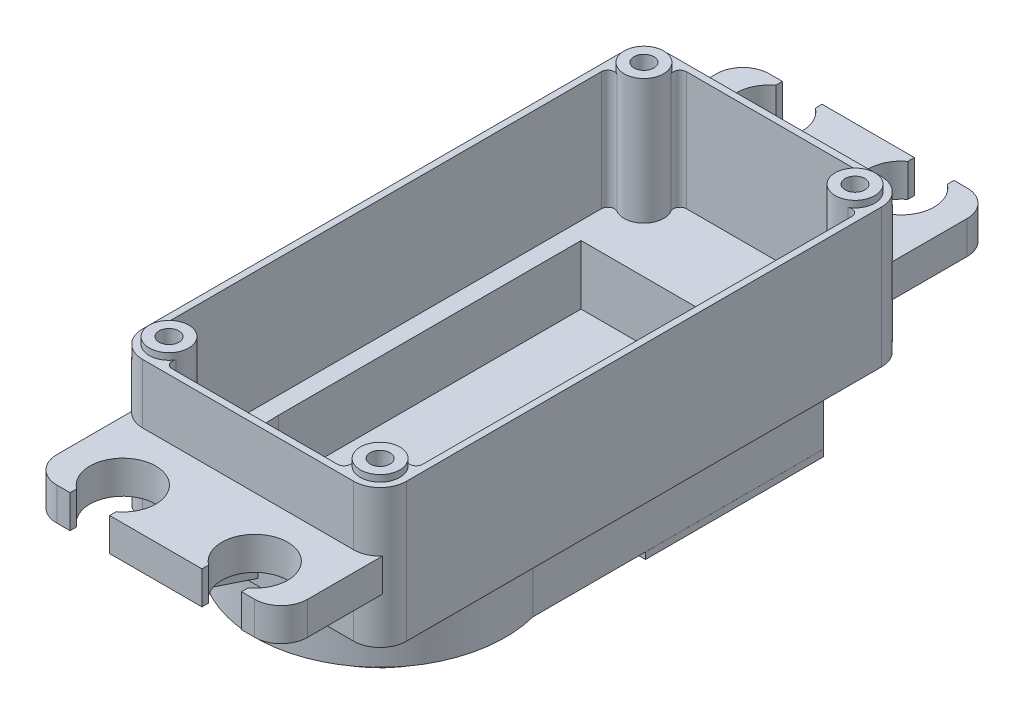
from build123d import *
from build123d.topology import SkipClean

# Parameters (mm, degrees)
ESQUISSE1_W                                     = 40
ESQUISSE1_H                                     = 10.5
BOSS_EXTRU_1_DEPTH                              = 0.8000000000000019
BOSS_EXTRU_2_DEPTH                              = 18.4
BOSS_EXTRU_3_DEPTH                              = 0.7999999999999987
BOSS_EXTRU_4_DEPTH                              = 3.499999999999998
BOSS_EXTRU_5_DEPTH                              = 0.5000000000000004
BOSS_EXTRU_6_DEPTH                              = 0.5000000000000004
ESQUISSE7_W                                     = 19
ESQUISSE7_H                                     = 2.5
BOSS_EXTRU_7_DEPTH                              = 7
BOSS_EXTRU_8_DEPTH                              = 7
BOSS_EXTRU_9_DEPTH                              = 2.4999999999999987
ENL_V_MAT_EXTRU_5_DEPTH                         = 2
ENL_V_MAT_EXTRU_6_DEPTH                         = 0.5000000000000004
DIAM_TRE_DU_PER_AGE_1_5_1_5_1_D                 = 1.5
DIAM_TRE_DU_PER_AGE_1_5_1_5_1_DEPTH             = 2
CHAMBRAGE_POUR_VIS_T_TE_CYLINDRIQUE_D           = 2
CHAMBRAGE_POUR_VIS_T_TE_CYLINDRIQUE_DEPTH       = 16.8
CHAMBRAGE_POUR_VIS_T_TE_CYLINDRIQUE_CBORE_D     = 5.5
CHAMBRAGE_POUR_VIS_T_TE_CYLINDRIQUE_CBORE_DEPTH = 1.5
NERVURE1_START                                  = -0.75
NERVURE1_DEPTH                                  = 1.5
NERVURE2_START                                  = -0.75
NERVURE2_DEPTH                                  = 1.5
CONG_4_R                                        = 1.2
CONG_5_R                                        = 2
ENL_V_MAT_EXTRU_7_DEPTH                         = 10
CONG_6_START                                    = -3
CONG_6_DEPTH                                    = 3
CONG_7_R                                        = 0.5
ENL_V_START                                     = -6.9999999999999964
ENL_V_MAT_EXTRU_8_DEPTH                         = 6.9999999999999964
ESQUISSE29_R                                    = 5.974465748667868
ENL_V_MAT_EXTRU_9_DEPTH                         = 5.9999999999999964
ENL_V_MAT_EXTRU_10_DEPTH                        = 4.5
ESQUISSE31_R                                    = 1.5000000000000009
ESQUISSE31_R_2                                  = 0.7499999999999878
ESQUISSE31_R_3                                  = 0.7499999999999954
ESQUISSE31_R_4                                  = 1.4999999999999973
ESQUISSE31_R_5                                  = 0.7499999999999971
BOSS_EXTRU_10_DEPTH                             = 0.5


with BuildPart() as part:
    # Esquisse1 → Boss.-Extru.1 (new body)
    with BuildSketch(Plane(origin=(-10.446500956022929, 0, 0), x_dir=(0, 0, -1), z_dir=(1, 0, 0))):
        with Locations((-31.770554493307827, -5.25)):
            Rectangle(ESQUISSE1_W, ESQUISSE1_H)
    extrude(amount=-BOSS_EXTRU_1_DEPTH)

    # Esquisse2 → Boss.-Extru.2 (add)
    with BuildSketch(Plane.ZY.offset(11.246500956022931)):
        Polygon((12.570554493307831, -11), (12.570554493307831, -10.5), (11.770554493307829, -10.5), (11.770554493307836, 0), (51.77055449330783, 0), (51.77055449330783, -10.5), (50.97055449330782, -10.5), (50.97055449330782, -11), align=None)
    extrude(amount=BOSS_EXTRU_2_DEPTH)

    # Esquisse3 → Boss.-Extru.3 (add)
    with BuildSketch(Plane.ZY.offset(29.64650095602293)):
        Polygon((11.770554493307838, 0), (51.77055449330783, 0), (51.77055449330783, -10.5), (11.77055449330783, -10.5), align=None)
    extrude(amount=BOSS_EXTRU_3_DEPTH)

    # Esquisse4 → Boss.-Extru.4 (add)
    with BuildSketch(Plane.XZ.offset(11)):
        with BuildLine():
            Line((-29.646500956022926, 17.35331386569952), (-29.646500956022926, 39.402010636842434))
            ThreePointArc((-29.646500956022926, 39.402010636842434), (-20.443205964941416, 51.270553921888535), (-11.24814618644997, 39.395629329629095))
            Line((-11.24814618644997, 39.395629329629095), (-11.248146186449967, 17.353313865699523))
            Line((-11.248146186449967, 17.353313865699523), (-29.646500956022926, 17.35331386569952))
        make_face()
    extrude(amount=BOSS_EXTRU_4_DEPTH)

    # Esquisse5 → Boss.-Extru.5 (add)
    with BuildSketch(Plane.XZ.offset(14.499999999999996)):
        Polygon((-29.646500956022926, 30.85331396465751), (-11.246500956022928, 30.85331396465751), (-11.246500956022928, 17.35331392707599), (-29.646500956022926, 17.353313927075988), align=None)
    extrude(amount=BOSS_EXTRU_5_DEPTH)

    # Esquisse6 → Boss.-Extru.6 (add)
    with BuildSketch(Plane.XZ.offset(14.499999999999996)):
        with BuildLine():
            Line((-18.155213108545006, 30.853313927075984), (-22.737788803500845, 30.853313927075984))
            ThreePointArc((-22.737788803500845, 30.853313927075984), (-20.446500956022927, 32.35331392707598), (-18.155213108545006, 30.853313927075984))
        make_face()
    extrude(amount=BOSS_EXTRU_6_DEPTH)

    # Esquisse7 → Boss.-Extru.7 (add)
    with BuildSketch(Plane.XY.offset(51.77055449330783)):
        with Locations((-20.446500956022934, -5.750000000000001)):
            Rectangle(ESQUISSE7_W, ESQUISSE7_H)
    extrude(amount=BOSS_EXTRU_7_DEPTH)

    # Esquisse10 → Boss.-Extru.8 (add)
    with BuildSketch(Plane(origin=(0, 0, 11.770554493307827), x_dir=(-1, 0, 0), z_dir=(0, 0, -1))):
        Polygon((29.94650095602292, -4.500000000000001), (29.94650095602292, -7.000000000000001), (10.946500956022927, -7.000000000000001), (10.946500956022925, -4.500000000000001), align=None)
    extrude(amount=BOSS_EXTRU_8_DEPTH)

    # Esquisse13 → Boss.-Extru.9 (add)
    with BuildSketch(Plane.XZ.offset(11)):
        with BuildLine():
            Line((-24.731395334360055, 17.353313927075984), (-16.161681220108637, 17.353313927075984))
            ThreePointArc((-16.161681220108637, 17.353313927075984), (-20.446538277234346, 15.553313927075983), (-24.731395334360055, 17.353313927075984))
        make_face()
    extrude(amount=BOSS_EXTRU_9_DEPTH)

    # Esquisse14 → Enlèv. mat.-Extru.5 (cut)
    with BuildSketch(Plane(origin=(0, 0, 0), x_dir=(-1, 0, 0), z_dir=(0, 1, 0))):
        with BuildLine():
            Line((10.946500956022929, 49.77055449330783), (10.946500956022927, 13.770554493307829))
            ThreePointArc((10.946500956022927, 13.770554493307829), (13.507161127802748, 14.83121466508765), (12.446500956022927, 12.270554493307827))
            Line((12.446500956022927, 12.270554493307827), (28.446500956022927, 12.270554493307827))
            ThreePointArc((28.446500956022927, 12.270554493307827), (27.385840784243104, 14.831214665087652), (29.946500956022927, 13.770554493307829))
            Line((29.946500956022927, 13.770554493307829), (29.946500956022927, 49.77055449330783))
            ThreePointArc((29.946500956022927, 49.77055449330783), (27.38584078424311, 48.70989432152801), (28.44650095602293, 51.27055449330783))
            Line((28.44650095602293, 51.27055449330783), (12.44650095602293, 51.27055449330783))
            ThreePointArc((12.44650095602293, 51.27055449330783), (13.507161127802751, 48.709894321528004), (10.946500956022929, 49.77055449330783))
        make_face()
    extrude(amount=-ENL_V_MAT_EXTRU_5_DEPTH, mode=Mode.SUBTRACT)

    # Esquisse15 → Enlèv. mat.-Extru.6 (cut)
    with BuildSketch(Plane.XZ.offset(14.999999999999998)):
        Polygon((-12.246500956022928, 29.853313927075984), (-28.646500956022926, 29.853313927075984), (-28.646500956022926, 18.353313927075984), (-12.246500956022928, 18.353313927075988), align=None)
    extrude(amount=-ENL_V_MAT_EXTRU_6_DEPTH, mode=Mode.SUBTRACT)

    # Esquisse20 → Révolution1 (revolve)
    with BuildSketch(Plane(origin=(0, 0, 41.77055449330783), x_dir=(-1, 0, 0), z_dir=(0, 0, -1)), mode=Mode.PRIVATE) as r_volution1_sk:
        Polygon((15.446500956022925, -16.8), (20.446500956022927, -16.8), (20.446500956022927, -14.499999999999996), (13.446500956022927, -14.499999999999996), (13.446500956022927, -16.299999999999997), (15.446500956022925, -16.299999999999997), align=None)
    revolve(r_volution1_sk.sketch.rotate(Axis((-20.446500956022927, -16.8, 41.77055449330783), (0, 1, 0)), 270), axis=Axis((-20.446500956022927, -16.8, 41.77055449330783), (0, 1, 0)))

    # Diamètre du perçage Ø1.5 (1.5)1
    with Locations(Plane(origin=(0, 0, 0), x_dir=(1, 0, 0), z_dir=(0, 1, 0))):
        with Locations((-12.446500956, -49.770554493), (-28.446500956, -49.770554493), (-12.446500956, -13.770554493), (-28.446500956, -13.770554493)):
            Hole(DIAM_TRE_DU_PER_AGE_1_5_1_5_1_D / 2, depth=DIAM_TRE_DU_PER_AGE_1_5_1_5_1_DEPTH)

    # Chambrage pour vis à tête cylindrique à 6 pans creux (ou vis CHC) M1.61
    with Locations(Plane(origin=(0, -16.8, 0), x_dir=(-1, 0, 0), z_dir=(0, -1, 0))):
        with Locations((20.446500956, -41.770554493)):
            CounterBoreHole(CHAMBRAGE_POUR_VIS_T_TE_CYLINDRIQUE_D / 2, CHAMBRAGE_POUR_VIS_T_TE_CYLINDRIQUE_CBORE_D / 2, CHAMBRAGE_POUR_VIS_T_TE_CYLINDRIQUE_CBORE_DEPTH, depth=CHAMBRAGE_POUR_VIS_T_TE_CYLINDRIQUE_DEPTH)

    # Nervure1: read off the stored shape, not the designer's step
    # Nervure1 outline → Nervure1 (add)
    with BuildSketch(Plane(origin=(-20.446500956022927, 0, 0), x_dir=(0, -1, 0), z_dir=(-1, 0, 0)).offset(NERVURE1_START)):
        Polygon((10, 51.770554493), (8, 57.770554493), (7, 57.770554493), (7, 51.770554493), align=None)
    extrude(amount=NERVURE1_DEPTH)

    # Nervure2: read off the stored shape, not the designer's step
    # Nervure2 outline → Nervure2 (add)
    with BuildSketch(Plane(origin=(-20.446500956022927, 0, 0), x_dir=(0, -1, 0), z_dir=(-1, 0, 0)).offset(NERVURE2_START)):
        Polygon((7, 11.770554493), (7, 5.770554493), (8, 5.770554493), (10, 11.770554493), align=None)
    extrude(amount=NERVURE2_DEPTH)

    # Congé4
    cong_4_edges = [part.edges().sort_by_distance(p)[0] for p in [
        (-11.246500956022931, -10.75, 50.97055449330782),
        (-29.64650095602293, -10.75, 12.570554493307831),
        (-11.246500956022931, -10.75, 12.570554493307831),
        (-29.64650095602293, -10.75, 50.97055449330782),
    ]]
    fillet(cong_4_edges, radius=CONG_4_R)

    # Congé5
    # the kernel refuses this fillet: 2 mm, written as the material it takes off along each edge
    with BuildSketch(Plane(origin=(-30.446500956022927, -15.5, 11.770554493307827), x_dir=(-1.78e-15, -6.8e-16, 1), z_dir=(0, 1, 6.8e-16))) as cong_5_piece_1_section:
        with BuildLine():
            CenterArc((CONG_5_R, CONG_5_R), CONG_5_R, 180.0000000000001, 90)
            Line((-3.55e-15, CONG_5_R), (0, 0))
            Line((0, 0), (CONG_5_R, 0))
        make_face()
    cong_5_piece_1 = extrude(amount=20.5, mode=Mode.PRIVATE)
    cong_5_piece_1 = split(cong_5_piece_1, bisect_by=Plane(origin=(-30.446500956022927, -7, 11.770554493307827), z_dir=(0, -1, 0)), keep=Keep.TOP, mode=Mode.PRIVATE)
    cong_5_piece_1 = split(cong_5_piece_1, bisect_by=Plane(origin=(-29.94650095602292, -15.5, 11.770554493307827), z_dir=(-1, 0, 0)), keep=Keep.TOP, mode=Mode.PRIVATE)
    add(cong_5_piece_1, mode=Mode.SUBTRACT)
    with BuildSketch(Plane(origin=(-30.446500956022927, -15.5, 11.770554493307827), x_dir=(-1.78e-15, -6.8e-16, 1), z_dir=(0, 1, 6.8e-16))) as cong_5_piece_2_section:
        with BuildLine():
            CenterArc((CONG_5_R, CONG_5_R), CONG_5_R, 180.0000000000001, 90)
            Line((-3.55e-15, CONG_5_R), (0, 0))
            Line((0, 0), (CONG_5_R, 0))
        make_face()
    cong_5_piece_2 = extrude(amount=20.5, mode=Mode.PRIVATE)
    cong_5_piece_2 = split(cong_5_piece_2, bisect_by=Plane(origin=(-30.446500956022927, -7, 11.770554493307827), z_dir=(0, -1, 0)), keep=Keep.TOP, mode=Mode.PRIVATE)
    cong_5_piece_2 = split(cong_5_piece_2, bisect_by=Plane(origin=(-29.94650095602292, -15.5, 11.770554493307827), z_dir=(1, 0, 0)), keep=Keep.TOP, mode=Mode.PRIVATE)
    add(cong_5_piece_2, mode=Mode.SUBTRACT)
    with BuildSketch(Plane(origin=(-30.446500956022927, -15.5, 11.770554493307827), x_dir=(-1.78e-15, -6.8e-16, 1), z_dir=(0, 1, 6.8e-16))) as cong_5_piece_3_section:
        with BuildLine():
            CenterArc((CONG_5_R, CONG_5_R), CONG_5_R, 180.0000000000001, 90)
            Line((-3.55e-15, CONG_5_R), (0, 0))
            Line((0, 0), (CONG_5_R, 0))
        make_face()
    cong_5_piece_3 = extrude(amount=20.5, mode=Mode.PRIVATE)
    cong_5_piece_3 = split(cong_5_piece_3, bisect_by=Plane(origin=(-30.446500956022927, -7, 11.770554493307827), z_dir=(0, 1, 0)), keep=Keep.TOP, mode=Mode.PRIVATE)
    cong_5_piece_3 = split(cong_5_piece_3, bisect_by=Plane(origin=(-29.94650095602292, -15.5, 11.770554493307827), z_dir=(-1, 0, 0)), keep=Keep.TOP, mode=Mode.PRIVATE)
    cong_5_piece_3 = split(cong_5_piece_3, bisect_by=Plane(origin=(-30.446500956022927, -4.5, 11.770554493307827), z_dir=(0, -1, 0)), keep=Keep.TOP, mode=Mode.PRIVATE)
    add(cong_5_piece_3, mode=Mode.SUBTRACT)
    with BuildSketch(Plane(origin=(-30.446500956022927, -15.5, 11.770554493307827), x_dir=(-1.78e-15, -6.8e-16, 1), z_dir=(0, 1, 6.8e-16))) as cong_5_piece_4_section:
        with BuildLine():
            CenterArc((CONG_5_R, CONG_5_R), CONG_5_R, 180.0000000000001, 90)
            Line((-3.55e-15, CONG_5_R), (0, 0))
            Line((0, 0), (CONG_5_R, 0))
        make_face()
    cong_5_piece_4 = extrude(amount=20.5, mode=Mode.PRIVATE)
    cong_5_piece_4 = split(cong_5_piece_4, bisect_by=Plane(origin=(-29.94650095602292, -15.5, 11.770554493307827), z_dir=(-1, 0, 0)), keep=Keep.TOP, mode=Mode.PRIVATE)
    cong_5_piece_4 = split(cong_5_piece_4, bisect_by=Plane(origin=(-30.446500956022927, -4.5, 11.770554493307827), z_dir=(0, 1, 0)), keep=Keep.TOP, mode=Mode.PRIVATE)
    add(cong_5_piece_4, mode=Mode.SUBTRACT)
    with BuildSketch(Plane(origin=(-30.446500956022927, -15.5, 11.770554493307827), x_dir=(-1.78e-15, -6.8e-16, 1), z_dir=(0, 1, 6.8e-16))) as cong_5_piece_5_section:
        with BuildLine():
            CenterArc((CONG_5_R, CONG_5_R), CONG_5_R, 180.0000000000001, 90)
            Line((-3.55e-15, CONG_5_R), (0, 0))
            Line((0, 0), (CONG_5_R, 0))
        make_face()
    cong_5_piece_5 = extrude(amount=20.5, mode=Mode.PRIVATE)
    cong_5_piece_5 = split(cong_5_piece_5, bisect_by=Plane(origin=(-29.94650095602292, -15.5, 11.770554493307827), z_dir=(1, 0, 0)), keep=Keep.TOP, mode=Mode.PRIVATE)
    cong_5_piece_5 = split(cong_5_piece_5, bisect_by=Plane(origin=(-30.446500956022927, -4.5, 11.770554493307827), z_dir=(0, 1, 0)), keep=Keep.TOP, mode=Mode.PRIVATE)
    add(cong_5_piece_5, mode=Mode.SUBTRACT)
    with BuildSketch(Plane(origin=(-10.94650095602293, -12, 4.770554493307827), x_dir=(0, 0, 1), z_dir=(7.1e-16, 1, 0)), Plane(origin=(-29.94650095602292, 0.4999999999999991, 4.770554493307827), x_dir=(0, 0, 1), z_dir=(0, -1, 0))) as cong_5_piece_6:
        with BuildLine():
            CenterArc((CONG_5_R, -CONG_5_R), CONG_5_R, 90, 90)
            Line((0, -CONG_5_R), (0, 0))
            Line((0, 0), (CONG_5_R, 0))
        make_face()
    extrude(amount=12.5, mode=Mode.SUBTRACT)
    with BuildSketch(Plane(origin=(-10.946500956022932, 0.4999999999999991, 58.77055449330783), x_dir=(0, 0, -1), z_dir=(0, -1, 0))) as cong_5_piece_7:
        with BuildLine():
            CenterArc((CONG_5_R, -CONG_5_R), CONG_5_R, 90, 90)
            Line((0, -CONG_5_R), (0, 0))
            Line((0, 0), (CONG_5_R, 0))
        make_face()
    extrude(amount=12.5, mode=Mode.SUBTRACT)
    with BuildSketch(Plane(origin=(-10.446500956022929, -15.5, 11.770554493307827), x_dir=(-1, 0, 0), z_dir=(0, 1, 0))) as cong_5_piece_8_section:
        with BuildLine():
            CenterArc((CONG_5_R, CONG_5_R), CONG_5_R, 180, 90)
            Line((0, CONG_5_R), (0, 0))
            Line((0, 0), (CONG_5_R, 0))
        make_face()
    cong_5_piece_8 = extrude(amount=20.5, mode=Mode.PRIVATE)
    cong_5_piece_8 = split(cong_5_piece_8, bisect_by=Plane(origin=(-10.946500956022934, -15.5, 11.770554493307827), z_dir=(-1, 7.1e-16, 0)), keep=Keep.TOP, mode=Mode.PRIVATE)
    cong_5_piece_8 = split(cong_5_piece_8, bisect_by=Plane(origin=(-10.446500956022929, -7, 11.770554493307827), z_dir=(0, -1, 0)), keep=Keep.TOP, mode=Mode.PRIVATE)
    add(cong_5_piece_8, mode=Mode.SUBTRACT)
    with BuildSketch(Plane(origin=(-10.446500956022929, -15.5, 11.770554493307827), x_dir=(-1, 0, 0), z_dir=(0, 1, 0))) as cong_5_piece_9_section:
        with BuildLine():
            CenterArc((CONG_5_R, CONG_5_R), CONG_5_R, 180, 90)
            Line((0, CONG_5_R), (0, 0))
            Line((0, 0), (CONG_5_R, 0))
        make_face()
    cong_5_piece_9 = extrude(amount=20.5, mode=Mode.PRIVATE)
    cong_5_piece_9 = split(cong_5_piece_9, bisect_by=Plane(origin=(-10.946500956022934, -15.5, 11.770554493307827), z_dir=(1, -7.1e-16, 0)), keep=Keep.TOP, mode=Mode.PRIVATE)
    cong_5_piece_9 = split(cong_5_piece_9, bisect_by=Plane(origin=(-10.446500956022929, -7, 11.770554493307827), z_dir=(0, -1, 0)), keep=Keep.TOP, mode=Mode.PRIVATE)
    add(cong_5_piece_9, mode=Mode.SUBTRACT)
    with BuildSketch(Plane(origin=(-10.446500956022929, -15.5, 11.770554493307827), x_dir=(-1, 0, 0), z_dir=(0, 1, 0))) as cong_5_piece_10_section:
        with BuildLine():
            CenterArc((CONG_5_R, CONG_5_R), CONG_5_R, 180, 90)
            Line((0, CONG_5_R), (0, 0))
            Line((0, 0), (CONG_5_R, 0))
        make_face()
    cong_5_piece_10 = extrude(amount=20.5, mode=Mode.PRIVATE)
    cong_5_piece_10 = split(cong_5_piece_10, bisect_by=Plane(origin=(-10.946500956022932, -15.5, 11.770554493307827), z_dir=(1, -7.1e-16, 0)), keep=Keep.TOP, mode=Mode.PRIVATE)
    cong_5_piece_10 = split(cong_5_piece_10, bisect_by=Plane(origin=(-10.446500956022929, -7, 11.770554493307827), z_dir=(0, 1, 0)), keep=Keep.TOP, mode=Mode.PRIVATE)
    cong_5_piece_10 = split(cong_5_piece_10, bisect_by=Plane(origin=(-10.446500956022929, -4.5, 11.770554493307827), z_dir=(0, -1, 0)), keep=Keep.TOP, mode=Mode.PRIVATE)
    add(cong_5_piece_10, mode=Mode.SUBTRACT)
    with BuildSketch(Plane(origin=(-10.446500956022929, -15.5, 11.770554493307827), x_dir=(-1, 0, 0), z_dir=(0, 1, 0))) as cong_5_piece_11_section:
        with BuildLine():
            CenterArc((CONG_5_R, CONG_5_R), CONG_5_R, 180, 90)
            Line((0, CONG_5_R), (0, 0))
            Line((0, 0), (CONG_5_R, 0))
        make_face()
    cong_5_piece_11 = extrude(amount=20.5, mode=Mode.PRIVATE)
    cong_5_piece_11 = split(cong_5_piece_11, bisect_by=Plane(origin=(-10.946500956022932, -15.5, 11.770554493307827), z_dir=(-1, 7.1e-16, 0)), keep=Keep.TOP, mode=Mode.PRIVATE)
    cong_5_piece_11 = split(cong_5_piece_11, bisect_by=Plane(origin=(-10.446500956022929, -4.5, 11.770554493307827), z_dir=(0, 1, 0)), keep=Keep.TOP, mode=Mode.PRIVATE)
    add(cong_5_piece_11, mode=Mode.SUBTRACT)
    with BuildSketch(Plane(origin=(-10.446500956022929, -15.5, 11.770554493307827), x_dir=(-1, 0, 0), z_dir=(0, 1, 0))) as cong_5_piece_12_section:
        with BuildLine():
            CenterArc((CONG_5_R, CONG_5_R), CONG_5_R, 180, 90)
            Line((0, CONG_5_R), (0, 0))
            Line((0, 0), (CONG_5_R, 0))
        make_face()
    cong_5_piece_12 = extrude(amount=20.5, mode=Mode.PRIVATE)
    cong_5_piece_12 = split(cong_5_piece_12, bisect_by=Plane(origin=(-10.946500956022932, -15.5, 11.770554493307827), z_dir=(1, -7.1e-16, 0)), keep=Keep.TOP, mode=Mode.PRIVATE)
    cong_5_piece_12 = split(cong_5_piece_12, bisect_by=Plane(origin=(-10.446500956022929, -4.5, 11.770554493307827), z_dir=(0, 1, 0)), keep=Keep.TOP, mode=Mode.PRIVATE)
    add(cong_5_piece_12, mode=Mode.SUBTRACT)
    with BuildSketch(Plane(origin=(-10.446500956022929, 5, 51.77055449330783), x_dir=(-1, 0, 0), z_dir=(0, -1, 0))) as cong_5_piece_13_section:
        with BuildLine():
            CenterArc((CONG_5_R, CONG_5_R), CONG_5_R, 180, 90)
            Line((0, CONG_5_R), (0, 0))
            Line((0, 0), (CONG_5_R, 0))
        make_face()
    cong_5_piece_13 = extrude(amount=20.5, mode=Mode.PRIVATE)
    cong_5_piece_13 = split(cong_5_piece_13, bisect_by=Plane(origin=(-10.946500956022932, 5, 51.77055449330783), z_dir=(-1, 0, 0)), keep=Keep.TOP, mode=Mode.PRIVATE)
    cong_5_piece_13 = split(cong_5_piece_13, bisect_by=Plane(origin=(-10.446500956022929, -4.5, 51.77055449330783), z_dir=(0, 1, 0)), keep=Keep.TOP, mode=Mode.PRIVATE)
    add(cong_5_piece_13, mode=Mode.SUBTRACT)
    with BuildSketch(Plane(origin=(-10.446500956022929, 5, 51.77055449330783), x_dir=(-1, 0, 0), z_dir=(0, -1, 0))) as cong_5_piece_14_section:
        with BuildLine():
            CenterArc((CONG_5_R, CONG_5_R), CONG_5_R, 180, 90)
            Line((0, CONG_5_R), (0, 0))
            Line((0, 0), (CONG_5_R, 0))
        make_face()
    cong_5_piece_14 = extrude(amount=20.5, mode=Mode.PRIVATE)
    cong_5_piece_14 = split(cong_5_piece_14, bisect_by=Plane(origin=(-10.946500956022932, 5, 51.77055449330783), z_dir=(1, 0, 0)), keep=Keep.TOP, mode=Mode.PRIVATE)
    cong_5_piece_14 = split(cong_5_piece_14, bisect_by=Plane(origin=(-10.446500956022929, -4.5, 51.77055449330783), z_dir=(0, 1, 0)), keep=Keep.TOP, mode=Mode.PRIVATE)
    add(cong_5_piece_14, mode=Mode.SUBTRACT)
    with BuildSketch(Plane(origin=(-10.446500956022929, 5, 51.77055449330783), x_dir=(-1, 0, 0), z_dir=(0, -1, 0))) as cong_5_piece_15_section:
        with BuildLine():
            CenterArc((CONG_5_R, CONG_5_R), CONG_5_R, 180, 90)
            Line((0, CONG_5_R), (0, 0))
            Line((0, 0), (CONG_5_R, 0))
        make_face()
    cong_5_piece_15 = extrude(amount=20.5, mode=Mode.PRIVATE)
    cong_5_piece_15 = split(cong_5_piece_15, bisect_by=Plane(origin=(-10.446500956022929, -7, 51.77055449330783), z_dir=(0, 1, 0)), keep=Keep.TOP, mode=Mode.PRIVATE)
    cong_5_piece_15 = split(cong_5_piece_15, bisect_by=Plane(origin=(-10.946500956022932, 5, 51.77055449330783), z_dir=(1, 0, 0)), keep=Keep.TOP, mode=Mode.PRIVATE)
    cong_5_piece_15 = split(cong_5_piece_15, bisect_by=Plane(origin=(-10.446500956022929, -4.5, 51.77055449330783), z_dir=(0, -1, 0)), keep=Keep.TOP, mode=Mode.PRIVATE)
    add(cong_5_piece_15, mode=Mode.SUBTRACT)
    with BuildSketch(Plane(origin=(-10.446500956022929, 5, 51.77055449330783), x_dir=(-1, 0, 0), z_dir=(0, -1, 0))) as cong_5_piece_16_section:
        with BuildLine():
            CenterArc((CONG_5_R, CONG_5_R), CONG_5_R, 180, 90)
            Line((0, CONG_5_R), (0, 0))
            Line((0, 0), (CONG_5_R, 0))
        make_face()
    cong_5_piece_16 = extrude(amount=20.5, mode=Mode.PRIVATE)
    cong_5_piece_16 = split(cong_5_piece_16, bisect_by=Plane(origin=(-10.446500956022929, -7, 51.77055449330783), z_dir=(0, -1, 0)), keep=Keep.TOP, mode=Mode.PRIVATE)
    cong_5_piece_16 = split(cong_5_piece_16, bisect_by=Plane(origin=(-10.946500956022932, 5, 51.77055449330783), z_dir=(-1, 0, 0)), keep=Keep.TOP, mode=Mode.PRIVATE)
    add(cong_5_piece_16, mode=Mode.SUBTRACT)
    with BuildSketch(Plane(origin=(-10.446500956022929, 5, 51.77055449330783), x_dir=(-1, 0, 0), z_dir=(0, -1, 0))) as cong_5_piece_17_section:
        with BuildLine():
            CenterArc((CONG_5_R, CONG_5_R), CONG_5_R, 180, 90)
            Line((0, CONG_5_R), (0, 0))
            Line((0, 0), (CONG_5_R, 0))
        make_face()
    cong_5_piece_17 = extrude(amount=20.5, mode=Mode.PRIVATE)
    cong_5_piece_17 = split(cong_5_piece_17, bisect_by=Plane(origin=(-10.446500956022929, -7, 51.77055449330783), z_dir=(0, -1, 0)), keep=Keep.TOP, mode=Mode.PRIVATE)
    cong_5_piece_17 = split(cong_5_piece_17, bisect_by=Plane(origin=(-10.946500956022932, 5, 51.77055449330783), z_dir=(1, 0, 0)), keep=Keep.TOP, mode=Mode.PRIVATE)
    add(cong_5_piece_17, mode=Mode.SUBTRACT)
    with BuildSketch(Plane(origin=(-30.44650095602293, 5, 51.77055449330783), x_dir=(1, 0, 0), z_dir=(0, -1, 0))) as cong_5_piece_18_section:
        with BuildLine():
            CenterArc((CONG_5_R, -CONG_5_R), CONG_5_R, 90, 90)
            Line((0, -CONG_5_R), (0, 0))
            Line((0, 0), (CONG_5_R, 0))
        make_face()
    cong_5_piece_18 = extrude(amount=20.5, mode=Mode.PRIVATE)
    cong_5_piece_18 = split(cong_5_piece_18, bisect_by=Plane(origin=(-29.946500956022934, 5, 51.77055449330783), z_dir=(1, 0, 0)), keep=Keep.TOP, mode=Mode.PRIVATE)
    cong_5_piece_18 = split(cong_5_piece_18, bisect_by=Plane(origin=(-30.44650095602293, -4.5, 51.77055449330783), z_dir=(0, 1, 0)), keep=Keep.TOP, mode=Mode.PRIVATE)
    add(cong_5_piece_18, mode=Mode.SUBTRACT)
    with BuildSketch(Plane(origin=(-30.44650095602293, 5, 51.77055449330783), x_dir=(1, 0, 0), z_dir=(0, -1, 0))) as cong_5_piece_19_section:
        with BuildLine():
            CenterArc((CONG_5_R, -CONG_5_R), CONG_5_R, 90, 90)
            Line((0, -CONG_5_R), (0, 0))
            Line((0, 0), (CONG_5_R, 0))
        make_face()
    cong_5_piece_19 = extrude(amount=20.5, mode=Mode.PRIVATE)
    cong_5_piece_19 = split(cong_5_piece_19, bisect_by=Plane(origin=(-29.946500956022934, 5, 51.77055449330783), z_dir=(-1, 0, 0)), keep=Keep.TOP, mode=Mode.PRIVATE)
    cong_5_piece_19 = split(cong_5_piece_19, bisect_by=Plane(origin=(-30.44650095602293, -4.5, 51.77055449330783), z_dir=(0, 1, 0)), keep=Keep.TOP, mode=Mode.PRIVATE)
    add(cong_5_piece_19, mode=Mode.SUBTRACT)
    with BuildSketch(Plane(origin=(-30.44650095602293, 5, 51.77055449330783), x_dir=(1, 0, 0), z_dir=(0, -1, 0))) as cong_5_piece_20_section:
        with BuildLine():
            CenterArc((CONG_5_R, -CONG_5_R), CONG_5_R, 90, 90)
            Line((0, -CONG_5_R), (0, 0))
            Line((0, 0), (CONG_5_R, 0))
        make_face()
    cong_5_piece_20 = extrude(amount=20.5, mode=Mode.PRIVATE)
    cong_5_piece_20 = split(cong_5_piece_20, bisect_by=Plane(origin=(-29.946500956022934, 5, 51.77055449330783), z_dir=(-1, 0, 0)), keep=Keep.TOP, mode=Mode.PRIVATE)
    cong_5_piece_20 = split(cong_5_piece_20, bisect_by=Plane(origin=(-30.44650095602293, -7, 51.77055449330783), z_dir=(0, 1, 0)), keep=Keep.TOP, mode=Mode.PRIVATE)
    cong_5_piece_20 = split(cong_5_piece_20, bisect_by=Plane(origin=(-30.44650095602293, -4.5, 51.77055449330783), z_dir=(0, -1, 0)), keep=Keep.TOP, mode=Mode.PRIVATE)
    add(cong_5_piece_20, mode=Mode.SUBTRACT)
    with BuildSketch(Plane(origin=(-30.44650095602293, 5, 51.77055449330783), x_dir=(1, 0, 0), z_dir=(0, -1, 0))) as cong_5_piece_21_section:
        with BuildLine():
            CenterArc((CONG_5_R, -CONG_5_R), CONG_5_R, 90, 90)
            Line((0, -CONG_5_R), (0, 0))
            Line((0, 0), (CONG_5_R, 0))
        make_face()
    cong_5_piece_21 = extrude(amount=20.5, mode=Mode.PRIVATE)
    cong_5_piece_21 = split(cong_5_piece_21, bisect_by=Plane(origin=(-29.946500956022934, 5, 51.77055449330783), z_dir=(1, 0, 0)), keep=Keep.TOP, mode=Mode.PRIVATE)
    cong_5_piece_21 = split(cong_5_piece_21, bisect_by=Plane(origin=(-30.44650095602293, -7, 51.77055449330783), z_dir=(0, -1, 0)), keep=Keep.TOP, mode=Mode.PRIVATE)
    add(cong_5_piece_21, mode=Mode.SUBTRACT)
    with BuildSketch(Plane(origin=(-30.44650095602293, 5, 51.77055449330783), x_dir=(1, 0, 0), z_dir=(0, -1, 0))) as cong_5_piece_22_section:
        with BuildLine():
            CenterArc((CONG_5_R, -CONG_5_R), CONG_5_R, 90, 90)
            Line((0, -CONG_5_R), (0, 0))
            Line((0, 0), (CONG_5_R, 0))
        make_face()
    cong_5_piece_22 = extrude(amount=20.5, mode=Mode.PRIVATE)
    cong_5_piece_22 = split(cong_5_piece_22, bisect_by=Plane(origin=(-29.946500956022934, 5, 51.77055449330783), z_dir=(-1, 0, 0)), keep=Keep.TOP, mode=Mode.PRIVATE)
    cong_5_piece_22 = split(cong_5_piece_22, bisect_by=Plane(origin=(-30.44650095602293, -7, 51.77055449330783), z_dir=(0, -1, 0)), keep=Keep.TOP, mode=Mode.PRIVATE)
    add(cong_5_piece_22, mode=Mode.SUBTRACT)
    with BuildSketch(Plane(origin=(-29.946500956022934, -12, 58.77055449330783), x_dir=(0, 0, -1), z_dir=(0, 1, 0))) as cong_5_piece_23:
        with BuildLine():
            CenterArc((CONG_5_R, -CONG_5_R), CONG_5_R, 90, 90)
            Line((0, -CONG_5_R), (0, 0))
            Line((0, 0), (CONG_5_R, 0))
        make_face()
    extrude(amount=12.5, mode=Mode.SUBTRACT)

    # Esquisse27 → Enlèv. mat.-Extru.7 (cut)
    with BuildSketch(Plane.XZ.offset(7.000000000000001)):
        with BuildLine():
            Line((-26.946500956022923, 58.270554493307834), (-26.946500956022923, 59.544005266820506))
            Line((-26.946500956022923, 59.544005266820506), (-23.946500956022923, 59.544005266820506))
            Line((-23.946500956022923, 59.544005266820506), (-23.946500956022923, 58.27055449330783))
            ThreePointArc((-23.946500956022923, 58.27055449330783), (-25.446500956022927, 53.770554493307834), (-26.946500956022923, 58.270554493307834))
        make_face()
        with BuildLine():
            Line((-13.946500956022925, 58.270554493307834), (-13.946500956022925, 59.544005266820506))
            Line((-13.946500956022925, 59.544005266820506), (-16.946500956022923, 59.544005266820506))
            Line((-16.946500956022923, 59.544005266820506), (-16.946500956022923, 58.270554493307834))
            ThreePointArc((-16.946500956022923, 58.270554493307834), (-15.446500956022923, 53.770554493307834), (-13.946500956022925, 58.270554493307834))
        make_face()
        with BuildLine():
            Line((-26.946500956022927, 5.270554493307833), (-26.946500956022927, 4.160335922019091))
            Line((-26.946500956022927, 4.160335922019091), (-23.946500956022923, 4.160335922019091))
            Line((-23.946500956022923, 4.160335922019091), (-23.946500956022923, 5.270554493307833))
            ThreePointArc((-23.946500956022923, 5.270554493307833), (-25.44650095602292, 9.770554493307829), (-26.946500956022927, 5.270554493307833))
        make_face()
        with BuildLine():
            Line((-13.946500956022925, 5.27055449330783), (-13.946500956022925, 4.160335922019091))
            Line((-13.946500956022925, 4.160335922019091), (-16.946500956022923, 4.160335922019091))
            Line((-16.946500956022923, 4.160335922019091), (-16.946500956022923, 5.27055449330783))
            ThreePointArc((-16.946500956022923, 5.27055449330783), (-15.446500956022923, 9.77055449330783), (-13.946500956022925, 5.27055449330783))
        make_face()
    extrude(amount=-ENL_V_MAT_EXTRU_7_DEPTH, mode=Mode.SUBTRACT)

    # Congé6: read off the stored shape, not the designer's step
    # Congé6 outline → Congé6 (add)
    with BuildSketch(Plane(origin=(0, 0, 0), x_dir=(1, 0, 0), z_dir=(0, 1, 0)).offset(CONG_6_START)):
        with BuildLine():
            Line((-29.946500956, -13.770554493), (-29.946500956, -15.502605301))
            ThreePointArc((-29.946500956, -15.502605301), (-29.696500956, -15.069592599), (-29.196500956, -15.069592599))
            ThreePointArc((-29.196500956, -15.069592599), (-29.745539062, -14.520554493), (-29.946500956, -13.770554493))
        make_face()
        with BuildLine():
            ThreePointArc((-29.196500956, -48.471516388), (-29.696500956, -48.471516388), (-29.946500956, -48.038503686))
            Line((-29.946500956, -48.038503686), (-29.946500956, -49.770554493))
            ThreePointArc((-29.946500956, -49.770554493), (-29.745539062, -49.020554493), (-29.196500956, -48.471516388))
        make_face()
        with BuildLine():
            ThreePointArc((-11.696500956, -15.069592599), (-11.196500956, -15.069592599), (-10.946500956, -15.502605301))
            Line((-10.946500956, -15.502605301), (-10.946500956, -13.770554493))
            ThreePointArc((-10.946500956, -13.770554493), (-11.14746285, -14.520554493), (-11.696500956, -15.069592599))
        make_face()
        with BuildLine():
            ThreePointArc((-10.946500956, -48.038503686), (-11.196500956, -48.471516388), (-11.696500956, -48.471516388))
            ThreePointArc((-11.696500956, -48.471516388), (-11.14746285, -49.020554493), (-10.946500956, -49.770554493))
            Line((-10.946500956, -49.770554493), (-10.946500956, -48.038503686))
        make_face()
    extrude(amount=CONG_6_DEPTH)

    # Congé7
    cong_7_edges = [part.edges().sort_by_distance(p)[0] for p in [
        (-12.44650095602293, -1, 51.27055449330783),
        (-28.44650095602293, -1, 51.27055449330783),
        (-28.446500956022927, -1, 12.270554493307827),
        (-12.446500956022927, -1, 12.270554493307827),
    ]]
    fillet(cong_7_edges, radius=CONG_7_R)

    # Esquisse28 → Enlèv. mat.-Extru.8 (cut)
    with BuildSketch(Plane(origin=(0, -2, 0), x_dir=(1, 0, 0), z_dir=(0, 1, 0)).offset(ENL_V_START)):
        with BuildLine():
            Line((-14.178551763591804, -12.270554493307827), (-26.71445014845405, -12.270554493307827))
            ThreePointArc((-26.71445014845405, -12.270554493307827), (-27.14746285034627, -12.520554493307827), (-27.14746285034627, -13.020554493307829))
            ThreePointArc((-27.14746285034627, -13.020554493307829), (-27.385840784243104, -14.831214665087652), (-29.196500956022927, -15.069592598984489))
            ThreePointArc((-29.196500956022927, -15.069592598984489), (-29.696500956022927, -15.069592598984489), (-29.946500956022927, -15.502605300876708))
            Line((-29.946500956022927, -15.502605300876708), (-29.946500956022927, -48.038503685738945))
            ThreePointArc((-29.946500956022927, -48.038503685738945), (-29.696500956022927, -48.47151638763116), (-29.196500956022927, -48.47151638763117))
            ThreePointArc((-29.196500956022927, -48.47151638763117), (-27.385840784243108, -48.709894321528004), (-27.147462850346272, -50.52055449330783))
            ThreePointArc((-27.147462850346272, -50.52055449330783), (-27.147462850346272, -51.02055449330783), (-26.714450148454056, -51.27055449330783))
            Line((-26.714450148454056, -51.27055449330783), (-14.178551763591809, -51.27055449330783))
            ThreePointArc((-14.178551763591809, -51.27055449330783), (-13.74553906169959, -51.02055449330783), (-13.745539061699589, -50.52055449330783))
            ThreePointArc((-13.745539061699589, -50.52055449330783), (-13.507161127802751, -48.709894321528004), (-11.696500956022929, -48.47151638763117))
            ThreePointArc((-11.696500956022929, -48.47151638763117), (-11.196500956022925, -48.47151638763117), (-10.946500956022929, -48.038503685738945))
            Line((-10.946500956022929, -48.038503685738945), (-10.946500956022927, -15.502605300876708))
            ThreePointArc((-10.946500956022927, -15.502605300876708), (-11.196500956022927, -15.069592598984489), (-11.696500956022927, -15.069592598984489))
            ThreePointArc((-11.696500956022927, -15.069592598984489), (-13.507161127802748, -14.831214665087648), (-13.745539061699583, -13.020554493307829))
            ThreePointArc((-13.745539061699583, -13.020554493307829), (-13.745539061699583, -12.520554493307829), (-14.178551763591804, -12.270554493307827))
        make_face()
    extrude(amount=ENL_V_MAT_EXTRU_8_DEPTH, mode=Mode.SUBTRACT)

    # Esquisse29 → Enlèv. mat.-Extru.9 (cut)
    with BuildSketch(Plane(origin=(0, -8.999999999999998, 0), x_dir=(1, 0, 0), z_dir=(0, 1, 0))):
        with Locations(Location((-20.446500956022927, -41.77055449330783, 0), (0, 0, 270))):
            Circle(ESQUISSE29_R)
    extrude(amount=-ENL_V_MAT_EXTRU_9_DEPTH, mode=Mode.SUBTRACT)

    # Esquisse30 → Enlèv. mat.-Extru.10 (cut)
    with BuildSketch(Plane(origin=(0, -8.999999999999998, 0), x_dir=(1, 0, 0), z_dir=(0, 1, 0))):
        with BuildLine():
            Line((-12.246500956022928, -18.353313927075988), (-28.629817953255206, -18.353313927075988))
            Line((-28.629817953255206, -18.353313927075988), (-28.629817953255206, -41.2977005072425))
            ThreePointArc((-28.629817953255206, -41.2977005072425), (-20.438159454639063, -49.67837794152739), (-12.246500956022928, -41.2977005072425))
            Line((-12.246500956022928, -41.2977005072425), (-12.246500956022928, -18.353313927075988))
        make_face()
    extrude(amount=-ENL_V_MAT_EXTRU_10_DEPTH, mode=Mode.SUBTRACT)

    # Esquisse31 → Boss.-Extru.10 (add)
    # profile 1 of 4: a face of its own
    with SkipClean():  # the faces are left unmerged after this step: merging them gives an invalid solid
        with BuildSketch(Plane(origin=(0, 0, 0), x_dir=(1, 0, 0), z_dir=(0, 1, 0))):
            with Locations(Location((-28.446500956022927, -13.770554493307829, 0), (0, 0, 270))):
                Circle(ESQUISSE31_R)
            with Locations(Location((-28.446500956022927, -13.770554493307829, 0), (0, 0, 270))):
                Circle(ESQUISSE31_R_2, mode=Mode.SUBTRACT)
        # profile 2 of 4: a face of its own
        with BuildSketch(Plane(origin=(0, 0, 0), x_dir=(1, 0, 0), z_dir=(0, 1, 0))):
            with Locations(Location((-12.446500956022927, -13.770554493307829, 0), (0, 0, 270))):
                Circle(ESQUISSE31_R)
            with Locations(Location((-12.446500956022927, -13.770554493307829, 0), (0, 0, 270))):
                Circle(ESQUISSE31_R_2, mode=Mode.SUBTRACT)
        # profile 3 of 4: a face of its own
        with BuildSketch(Plane(origin=(0, 0, 0), x_dir=(1, 0, 0), z_dir=(0, 1, 0))):
            with Locations(Location((-28.44650095602293, -49.77055449330783, 0), (0, 0, 270))):
                Circle(ESQUISSE31_R)
            with Locations(Location((-28.44650095602293, -49.77055449330783, 0), (0, 0, 270))):
                Circle(ESQUISSE31_R_3, mode=Mode.SUBTRACT)
        # profile 4 of 4: a face of its own
        with BuildSketch(Plane(origin=(0, 0, 0), x_dir=(1, 0, 0), z_dir=(0, 1, 0))):
            with Locations(Location((-12.44650095602293, -49.77055449330783, 0), (0, 0, 270))):
                Circle(ESQUISSE31_R_4)
            with Locations(Location((-12.44650095602293, -49.77055449330783, 0), (0, 0, 270))):
                Circle(ESQUISSE31_R_5, mode=Mode.SUBTRACT)
        extrude(amount=BOSS_EXTRU_10_DEPTH)


solid = part.part
